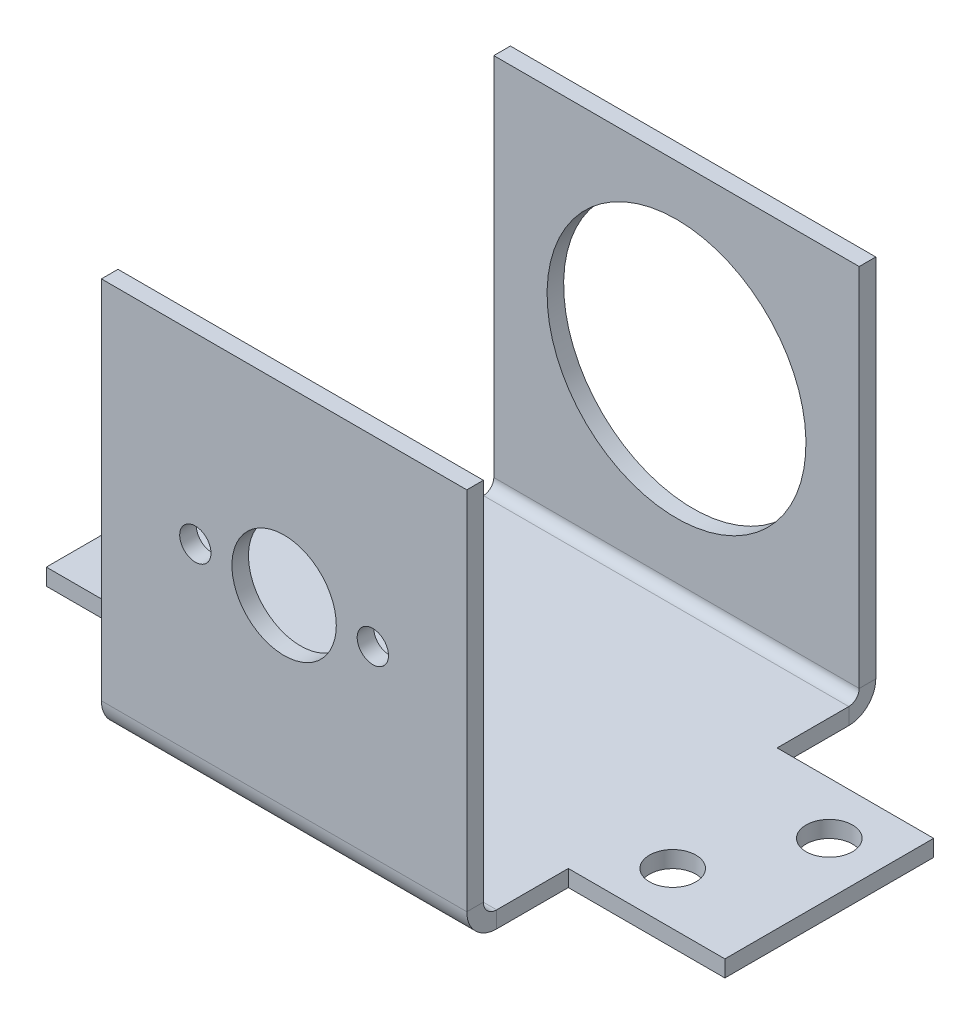
from build123d import *

# Parameters (mm, degrees)
SKETCH1_W                  = 35
SKETCH1_H                  = 35
SKETCH1_R                  = 1.5
SKETCH1_R_2                = 5
BOSS_EXTRUDE1_DEPTH        = 0.79375
CONVERT_SOLID2_START       = -0.79375
CONVERT_SOLID2_OUTLINE_W   = 35
CONVERT_SOLID2_OUTLINE_H   = 35
CONVERT_SOLID2_OUTLINE_R   = 1.5
CONVERT_SOLID2_OUTLINE_R_2 = 5
CONVERT_SOLID2_DEPTH       = 0.79375
EDGE_FLANGE1_DEPTH         = 35
EDGE_FLANGE2_DEPTH         = 35
SKETCH24_R                 = 12.4
CUT_EXTRUDE1_DEPTH         = 10
SKETCH29_W                 = 15
SKETCH29_H                 = 20
TAB1_DEPTH                 = 1.5875
SKETCH32_W                 = 15
SKETCH32_H                 = 20
TAB2_DEPTH                 = 1.5875
SKETCH35_R                 = 2.2225
CUT_EXTRUDE2_DEPTH         = 10


# Read off the part's stored shape, not the designer's step: Convert-Solid2
# Sheet-metal steps are written as plain solids
with BuildPart() as part:
    # Sketch1 → Boss-Extrude1 (new body)
    with BuildSketch(Plane.XY):
        Rectangle(SKETCH1_W, SKETCH1_H)
        with Locations((-8.5, 0)):
            Circle(SKETCH1_R, mode=Mode.SUBTRACT)
        with Locations((8.5, 0)):
            Circle(SKETCH1_R, mode=Mode.SUBTRACT)
        Circle(SKETCH1_R_2, mode=Mode.SUBTRACT)
    extrude(amount=BOSS_EXTRUDE1_DEPTH)

    # Convert-Solid2 outline → Convert-Solid2 (add)
    with BuildSketch(Plane.XY.offset(CONVERT_SOLID2_START)):
        Rectangle(CONVERT_SOLID2_OUTLINE_W, CONVERT_SOLID2_OUTLINE_H)
        with Locations((-8.5, 0)):
            Circle(CONVERT_SOLID2_OUTLINE_R, mode=Mode.SUBTRACT)
        Circle(CONVERT_SOLID2_OUTLINE_R_2, mode=Mode.SUBTRACT)
        with Locations((8.5, 0)):
            Circle(CONVERT_SOLID2_OUTLINE_R, mode=Mode.SUBTRACT)
    extrude(amount=CONVERT_SOLID2_DEPTH)

    # Edge-Flange1 section (across the edge) → Edge-Flange1 (add)
    with BuildSketch(Plane(origin=(17.5, -18.77, -0.79375), x_dir=(0, 1, 0), z_dir=(-1, 0, 0))):
        with BuildLine():
            Line((-1.5875, 1.27), (-1.5875, 35))
            Line((-1.5875, 35), (0, 35))
            Line((0, 35), (0, 1.27))
            ThreePointArc((0, 1.27), (0.371974388, 0.371974388), (1.27, 0))
            Line((1.27, 0), (1.27, -1.5875))
            ThreePointArc((1.27, -1.5875), (-0.750557627, -0.750557627), (-1.5875, 1.27))
        make_face()
    extrude(amount=EDGE_FLANGE1_DEPTH)

    # Edge-Flange2 section (across the edge) → Edge-Flange2 (add)
    with BuildSketch(Plane(origin=(17.5, -18.77, -36.79375), x_dir=(0, 0, 1), z_dir=(-1, 0, 0))):
        with BuildLine():
            Line((-1.5875, 1), (-1.5875, 36))
            Line((-1.5875, 36), (0, 36))
            Line((0, 36), (0, 1))
            ThreePointArc((0, 1), (0.292893219, 0.292893219), (1, 0))
            Line((1, 0), (1, -1.5875))
            ThreePointArc((1, -1.5875), (-0.829638796, -0.829638796), (-1.5875, 1))
        make_face()
    extrude(amount=EDGE_FLANGE2_DEPTH)

    # Sketch24 → Cut-Extrude1 (cut)
    with BuildSketch(Plane(origin=(0, 0, -38.38125), x_dir=(-1, 0, 0), z_dir=(0, 0, -1))):
        with Locations(Location((0, 0, 0), (0, 0, 90))):
            Circle(SKETCH24_R)
    extrude(amount=-CUT_EXTRUDE1_DEPTH, mode=Mode.SUBTRACT)

    # Sketch29 → Tab1 (add)
    with BuildSketch(Plane(origin=(0, -18.77, 0), x_dir=(1, 0, 0), z_dir=(0, 1, 0))):
        with Locations((25, 18.92875)):
            Rectangle(SKETCH29_W, SKETCH29_H)
    extrude(amount=-TAB1_DEPTH)

    # Sketch32 → Tab2 (add)
    with BuildSketch(Plane(origin=(0, -18.77, 0), x_dir=(1, 0, 0), z_dir=(0, 1, 0))):
        with Locations((-25, 18.92875)):
            Rectangle(SKETCH32_W, SKETCH32_H)
    extrude(amount=-TAB2_DEPTH)

    # Sketch35 → Cut-Extrude2 (cut)
    with BuildSketch(Plane(origin=(0, -18.77, 0), x_dir=(1, 0, 0), z_dir=(0, 1, 0))):
        with Locations(Location((22.5, 13.92875, 0), (0, 0, 270))):
            Circle(SKETCH35_R)
        with Locations(Location((27.5, 23.92875, 0), (0, 0, 270))):
            Circle(SKETCH35_R)
    cut_extrude2 = extrude(amount=-CUT_EXTRUDE2_DEPTH, mode=Mode.SUBTRACT)

    # Mirror1: Cut-Extrude2 across plane
    add(cut_extrude2.mirror(Plane(origin=(0, 0, 0), x_dir=(0, 0, 1), z_dir=(1, 0, 0))), mode=Mode.SUBTRACT)


solid = part.part
